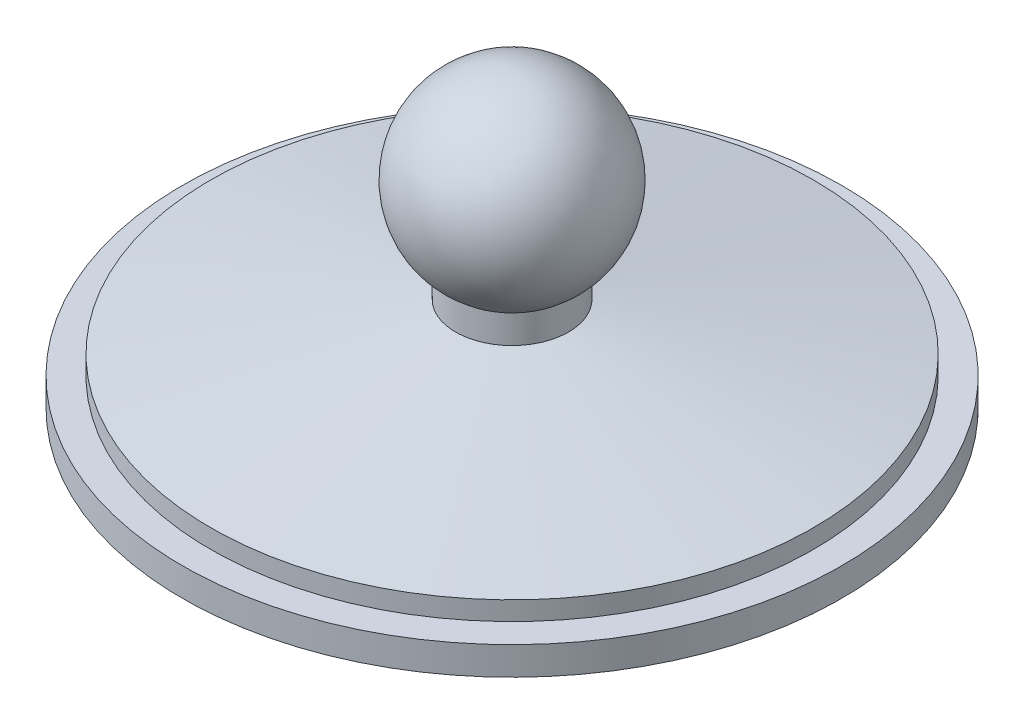
from build123d import *


# Read off the part's stored shape, not the designer's step: 抽壳1
with BuildPart() as part:
    # 草图1 → 旋转1 (revolve)
    with BuildSketch(Plane.XY, mode=Mode.PRIVATE) as revolve_1_sk:
        with BuildLine():
            Line((0, 0), (32, 0))
            Line((32, 0), (32, 2))
            Line((32, 2), (35, 2))
            Line((35, 2), (35, 5))
            Line((35, 5), (32, 5))
            Line((32, 5), (32, 7))
            Line((32, 7), (6, 12))
            Line((6, 12), (6, 15))
            ThreePointArc((6, 15), (9.486832981, 26.16227766), (0, 33))
            Line((0, 33), (0, 0))
        make_face()
    revolve(revolve_1_sk.sketch.rotate(Axis((0, 0, 0), (0, 1, 0)), 90), axis=Axis((0, 0, 0), (0, 1, 0)))

    # 抽壳1 outline → 抽壳1 (revolve, cut)
    with BuildSketch(Plane.XY):
        Polygon((29, 0), (29, 4.521953317), (0, 10.098876393), (0, 0), align=None)
    revolve(axis=Axis((0, 0, 0), (0, 1, 0)), mode=Mode.SUBTRACT)


solid = part.part
